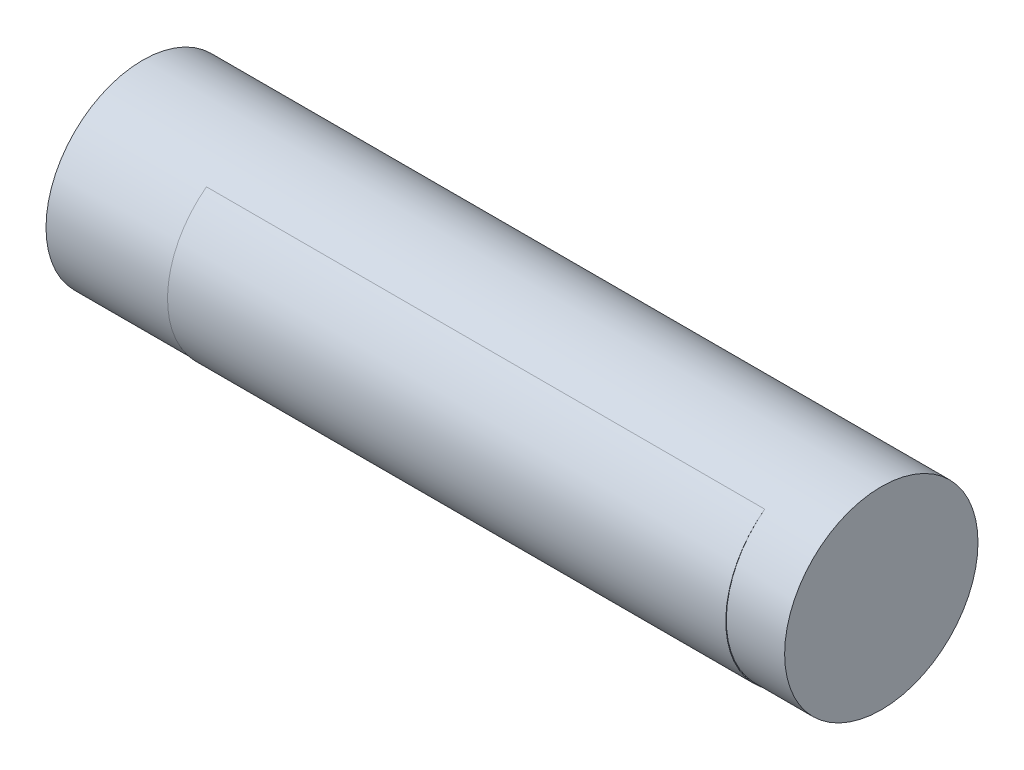
from build123d import *

# Parameters (mm, degrees)
SKETCH1_W                = 110
SKETCH1_H                = 19.05
BOSS_EXTRUDE1_DEPTH      = 72.39
BOSS_EXTRUDE1_DEPTH_BACK = 73.152
F_3DSKETCH1_R            = 19.05


with BuildPart() as part:
    # Sketch1 → Revolve1 (revolve)
    with BuildSketch(Plane.XY):
        with Locations((5.900498231, -5.722696838)):
            Rectangle(SKETCH1_W, SKETCH1_H)
    revolve(axis=Axis((-49.099501769, 3.802303162, 0), (1, 0, 0)))

    # 3DSketch1 → Boss-Extrude1 (add, two sides: drawn at the far end of the back side and taken through both)
    with BuildSketch(Plane(origin=(0, 3.882002719, -0.106266077), x_dir=(0, 0, 1), z_dir=(1, 0, 0)).offset(-BOSS_EXTRUDE1_DEPTH_BACK)):
        Circle(F_3DSKETCH1_R)
    extrude(amount=BOSS_EXTRUDE1_DEPTH + BOSS_EXTRUDE1_DEPTH_BACK)


solid = part.part
